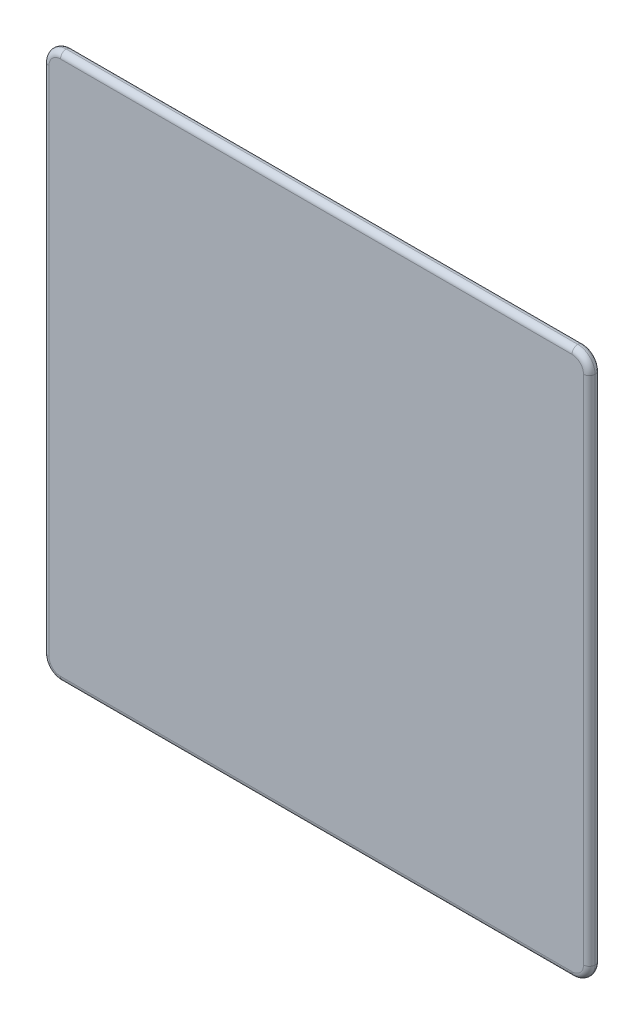
from build123d import *

# Parameters (mm, degrees)
SKETCH1_W           = 94.8
SKETCH1_H           = 94.8
BOSS_EXTRUDE1_DEPTH = 2
FILLET1_R           = 3
FILLET2_R           = 1


with BuildPart() as part:
    # Sketch1 → Boss-Extrude1 (new body)
    with BuildSketch(Plane(origin=(0, 0, 0), x_dir=(0, 1, 0), z_dir=(0, 0, 1))):
        Rectangle(SKETCH1_W, SKETCH1_H)
    extrude(amount=BOSS_EXTRUDE1_DEPTH)

    # Fillet1
    fillet1_edges = [part.edges().sort_by_distance(p)[0] for p in [
        (-47.4, -47.4, 1),
        (-47.4, 47.4, 1),
        (47.4, 47.4, 1),
        (47.4, -47.4, 1),
    ]]
    fillet(fillet1_edges, radius=FILLET1_R)

    # Fillet2
    fillet2_edges = [part.edges().sort_by_distance(p)[0] for p in [
        (46.521320344, 46.521320344, 0),
        (47.4, 0, 0),
        (46.521320344, -46.521320344, 0),
        (0, -47.4, 0),
        (-46.521320344, -46.521320344, 0),
        (-47.4, 0, 0),
        (-46.521320344, 46.521320344, 0),
        (46.521320344, 46.521320344, 2),
        (47.4, 0, 2),
        (46.521320344, -46.521320344, 2),
        (0, -47.4, 2),
        (-46.521320344, -46.521320344, 2),
        (-47.4, 0, 2),
        (-46.521320344, 46.521320344, 2),
        (0, 47.4, 2),
        (0, 47.4, 0),
    ]]
    fillet(fillet2_edges, radius=FILLET2_R - 0.0001)  # a hair under: the kernel refuses the full size


solid = part.part
